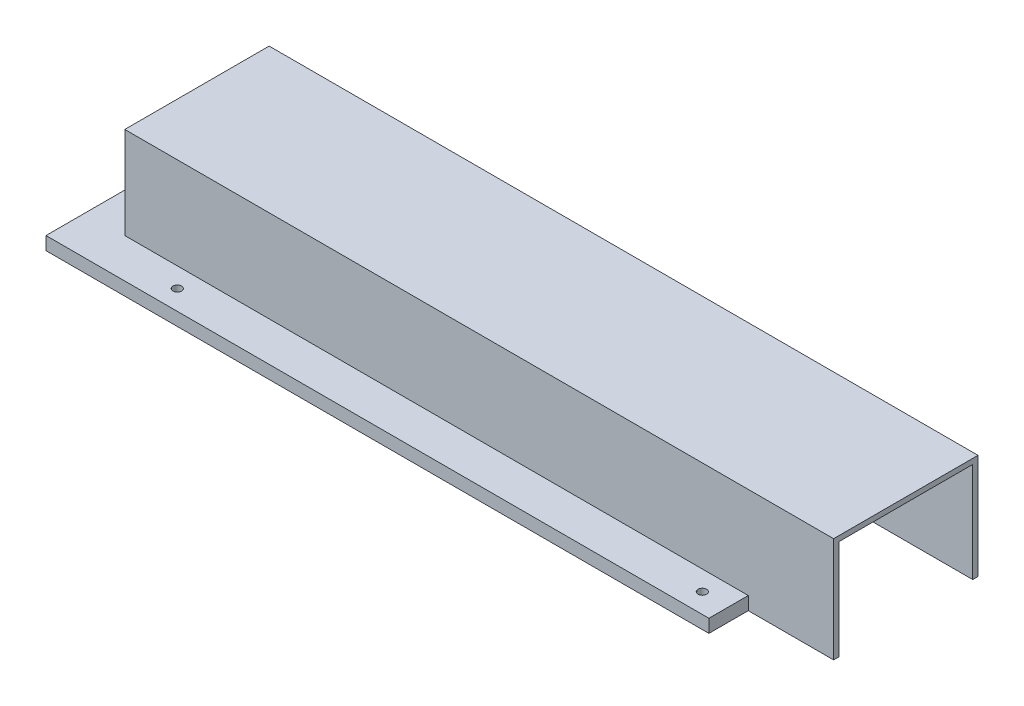
from build123d import *

# Parameters (mm, degrees)
SKETCH1_W             = 285
SKETCH1_H             = 85
SKETCH1_W_2           = 251
SKETCH1_H_2           = 51
BOSS_EXTRUDE1_DEPTH   = 5
SKETCH2_W             = 270
SKETCH2_H             = 55
SKETCH2_W_2           = 251
SKETCH2_H_2           = 51
BOSS_EXTRUDE2_DEPTH   = 35
SKETCH3_W             = 270
SKETCH3_H             = 55
BOSS_EXTRUDE3_DEPTH   = 2
SKETCH4_W             = 51
SKETCH4_H             = 38
CUT_EXTRUDE1_DEPTH    = 17
M4X0_7_TAPPED_HOLE1_D = 3.3
SKETCH8_W             = 32.5
SKETCH8_H             = 15
CUT_EXTRUDE2_DEPTH    = 10


with BuildPart() as part:
    # Sketch1 → Boss-Extrude1 (new body)
    with BuildSketch(Plane(origin=(0, 0, 0), x_dir=(1, 0, 0), z_dir=(0, 1, 0))):
        Rectangle(SKETCH1_W, SKETCH1_H)
        Rectangle(SKETCH1_W_2, SKETCH1_H_2, mode=Mode.SUBTRACT)
    extrude(amount=BOSS_EXTRUDE1_DEPTH)

    # Sketch2 → Boss-Extrude2 (add)
    with BuildSketch(Plane(origin=(0, 5, 0), x_dir=(1, 0, 0), z_dir=(0, 1, 0))):
        with Locations((7.5, 0)):
            Rectangle(SKETCH2_W, SKETCH2_H)
        Rectangle(SKETCH2_W_2, SKETCH2_H_2, mode=Mode.SUBTRACT)
    extrude(amount=BOSS_EXTRUDE2_DEPTH)

    # Sketch3 → Boss-Extrude3 (add)
    with BuildSketch(Plane(origin=(0, 40, 0), x_dir=(1, 0, 0), z_dir=(0, 1, 0))):
        with Locations((7.5, 0)):
            Rectangle(SKETCH3_W, SKETCH3_H)
    extrude(amount=-BOSS_EXTRUDE3_DEPTH)

    # Sketch4 → Cut-Extrude1 (cut)
    with BuildSketch(Plane(origin=(142.5, 0, 0), x_dir=(0, 0, -1), z_dir=(1, 0, 0))):
        with Locations((0, 19)):
            Rectangle(SKETCH4_W, SKETCH4_H)
    extrude(amount=-CUT_EXTRUDE1_DEPTH, mode=Mode.SUBTRACT)

    # M4x0.7 Tapped Hole1 (through all)
    with Locations(Plane(origin=(0, 5, 0), x_dir=(1, 0, 0), z_dir=(0, 1, 0))):
        with Locations((100, 35), (-100, -35), (-100, 35), (100, -35)):
            Hole(M4X0_7_TAPPED_HOLE1_D / 2)

    # Sketch8 → Cut-Extrude2 (cut)
    with BuildSketch(Plane(origin=(0, 5, 0), x_dir=(1, 0, 0), z_dir=(0, 1, 0))):
        with Locations((126.25, 35)):
            Rectangle(SKETCH8_W, SKETCH8_H)
        with Locations((126.25, -35)):
            Rectangle(SKETCH8_W, SKETCH8_H)
    extrude(amount=-CUT_EXTRUDE2_DEPTH, mode=Mode.SUBTRACT)


solid = part.part
